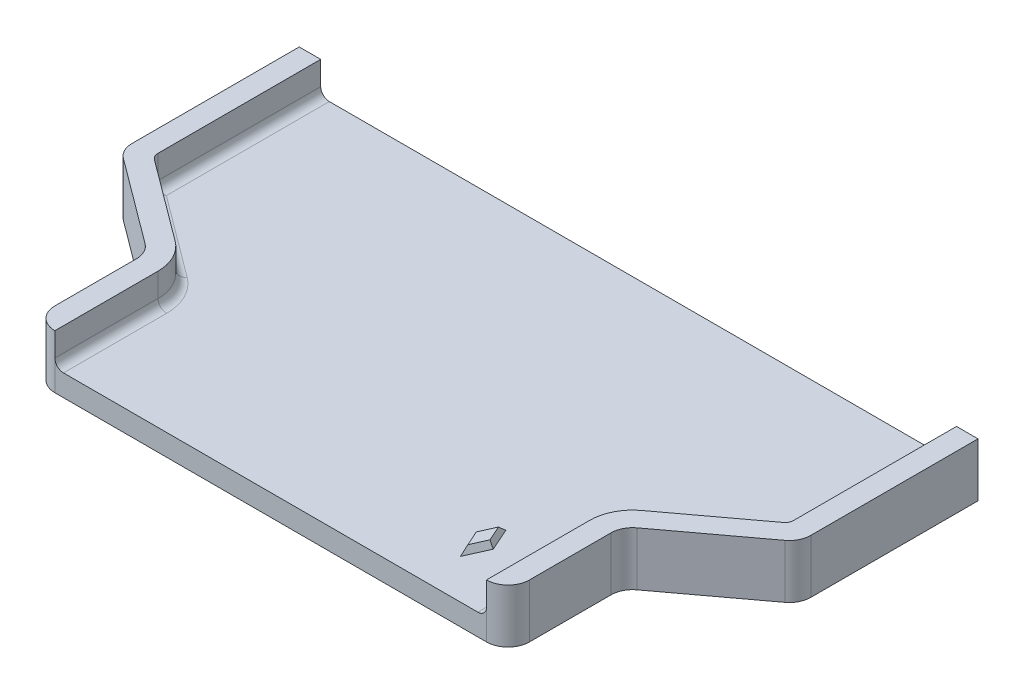
from build123d import *

# Parameters (mm, degrees)
EXTRUDE1_DEPTH = 6.35
SHELL1_START   = 2.54
SHELL1_DEPTH   = 3.81
FILLET2_R      = 1.016
EXTRUDE2_DEPTH = 0.762
EXTRUDE2_TAPER = 25


# Read off the part's stored shape, not the designer's step: Shell1
with BuildPart() as part:
    # Sketch1 → Extrude1 (new body)
    with BuildSketch(Plane(origin=(0, 0, 0), x_dir=(1, 0, 0), z_dir=(0, 1, 0))):
        with BuildLine():
            Line((-14.602264877, -43.480257116), (-65.610482537, -43.480257116))
            ThreePointArc((-65.610482537, -43.480257116), (-67.406533761, -42.73630834), (-68.150482537, -40.940257116))
            Line((-68.150482537, -40.940257116), (-68.150482537, -31.291332317))
            ThreePointArc((-68.150482537, -31.291332317), (-68.420760673, -30.151173267), (-69.174075183, -29.253659935))
            Line((-69.174075183, -29.253659935), (-79.189154769, -21.800577453))
            ThreePointArc((-79.189154769, -21.800577453), (-79.942469279, -20.903064121), (-80.212747415, -19.762905071))
            Line((-80.212747415, -19.762905071), (-80.212747415, 0))
            Line((-80.212747415, 0), (0, 0))
            Line((0, 0), (0, -19.762905071))
            ThreePointArc((0, -19.762905071), (-0.270278136, -20.903064121), (-1.023592646, -21.800577453))
            Line((-1.023592646, -21.800577453), (-11.038672231, -29.253659935))
            ThreePointArc((-11.038672231, -29.253659935), (-11.791986741, -30.151173267), (-12.062264877, -31.291332317))
            Line((-12.062264877, -31.291332317), (-12.062264877, -40.940257116))
            ThreePointArc((-12.062264877, -40.940257116), (-12.806213653, -42.73630834), (-14.602264877, -43.480257116))
        make_face()
    extrude(amount=EXTRUDE1_DEPTH)

    # Shell1 outline → Shell1 (cut)
    with BuildSketch(Plane(origin=(0, 0, 0), x_dir=(1, 0, 0), z_dir=(0, 1, 0)).offset(SHELL1_START)):
        with BuildLine():
            Line((-14.602264877, -43.480257116), (-14.602264877, -31.291332317))
            ThreePointArc((-14.602264877, -31.291332317), (-14.061708605, -29.011014216), (-12.555079586, -27.215987553))
            Line((-12.555079586, -27.215987553), (-2.54, -19.762905071))
            Line((-2.54, -19.762905071), (-2.54, 0))
            Line((-2.54, 0), (-77.672747415, 0))
            Line((-77.672747415, 0), (-77.672747415, -19.762905071))
            Line((-77.672747415, -19.762905071), (-67.657667829, -27.215987553))
            ThreePointArc((-67.657667829, -27.215987553), (-66.151038809, -29.011014216), (-65.610482537, -31.291332317))
            Line((-65.610482537, -31.291332317), (-65.610482537, -43.480257116))
            Line((-65.610482537, -43.480257116), (-14.602264877, -43.480257116))
        make_face()
    extrude(amount=SHELL1_DEPTH, mode=Mode.SUBTRACT)

    # Fillet2
    fillet2_edges = [part.edges().sort_by_distance(p)[0] for p in [
        (-14.602264877, 2.54, 37.385794717),
        (-14.061708605, 2.54, 29.011014216),
        (-7.547539793, 2.54, 23.489446312),
        (-2.54, 2.54, 9.881452535),
        (-2.54, 4.445, 19.762905071),
        (-77.672747415, 2.54, 9.881452535),
        (-72.665207622, 2.54, 23.489446312),
        (-77.672747415, 4.445, 19.762905071),
        (-66.151038809, 2.54, 29.011014216),
        (-65.610482537, 2.54, 37.385794717),
    ]]
    fillet(fillet2_edges, radius=FILLET2_R)

    # Sketch3 → Extrude2 (add)
    with BuildSketch(Plane(origin=(0, 2.54, 0), x_dir=(-1, 0, 0), z_dir=(0, 1, 0))):
        Polygon((22.356461774, 33.449057502), (23.555013556, 36.122749938), (22.356461774, 38.796442374), (21.157909992, 36.122749938), align=None)
    extrude(amount=EXTRUDE2_DEPTH, taper=EXTRUDE2_TAPER)


solid = part.part
